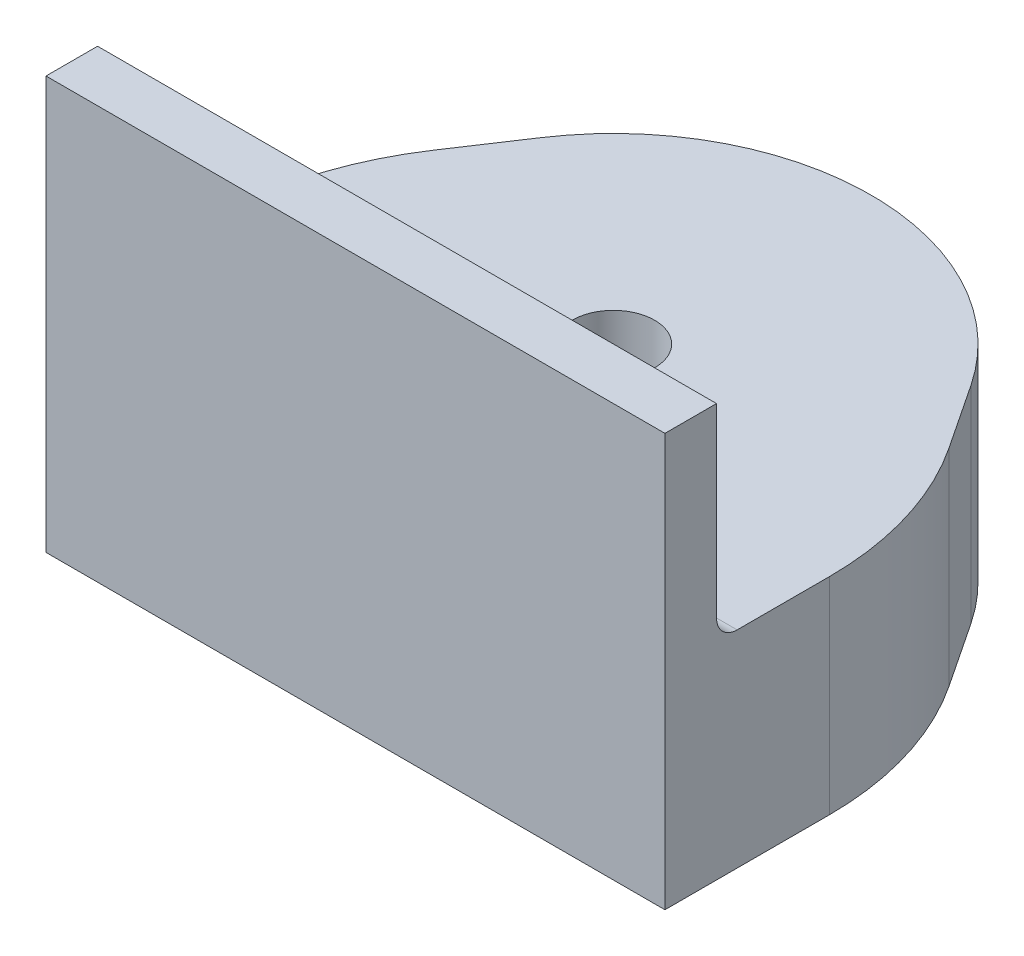
from build123d import *

# Parameters (mm, degrees)
SKETCH1_R           = 4
BOSS_EXTRUDE1_DEPTH = 20
SKETCH2_W           = 60
SKETCH2_H           = 5
BOSS_EXTRUDE2_DEPTH = 20
FILLET2_R           = 2
FILLET3_R           = 30


with BuildPart() as part:
    # Sketch1 → Boss-Extrude1 (new body)
    with BuildSketch(Plane(origin=(0, 0, 0), x_dir=(1, 0, 0), z_dir=(0, 1, 0))):
        with BuildLine():
            Line((30, -25), (-30, -25))
            Line((-30, -25), (-30, 0))
            Line((-30, 0), (-20.833333333, 13.81926996))
            ThreePointArc((-20.833333333, 13.81926996), (0, 25), (20.833333333, 13.81926996))
            Line((20.833333333, 13.81926996), (30, 0))
            Line((30, 0), (30, -25))
        make_face()
        Circle(SKETCH1_R, mode=Mode.SUBTRACT)
    extrude(amount=BOSS_EXTRUDE1_DEPTH)

    # Sketch2 → Boss-Extrude2 (add)
    with BuildSketch(Plane(origin=(0, 20, 0), x_dir=(1, 0, 0), z_dir=(0, 1, 0))):
        with Locations((0, -22.5)):
            Rectangle(SKETCH2_W, SKETCH2_H)
    extrude(amount=BOSS_EXTRUDE2_DEPTH)

    # Fillet2
    fillet2_edges = [part.edges().sort_by_distance(p)[0] for p in [
        (0, 20, 20),
    ]]
    fillet(fillet2_edges, radius=FILLET2_R)

    # Fillet3
    fillet3_edges = [part.edges().sort_by_distance(p)[0] for p in [
        (30, 10, 0),
        (-30, 10, 0),
    ]]
    fillet(fillet3_edges, radius=FILLET3_R)


solid = part.part
